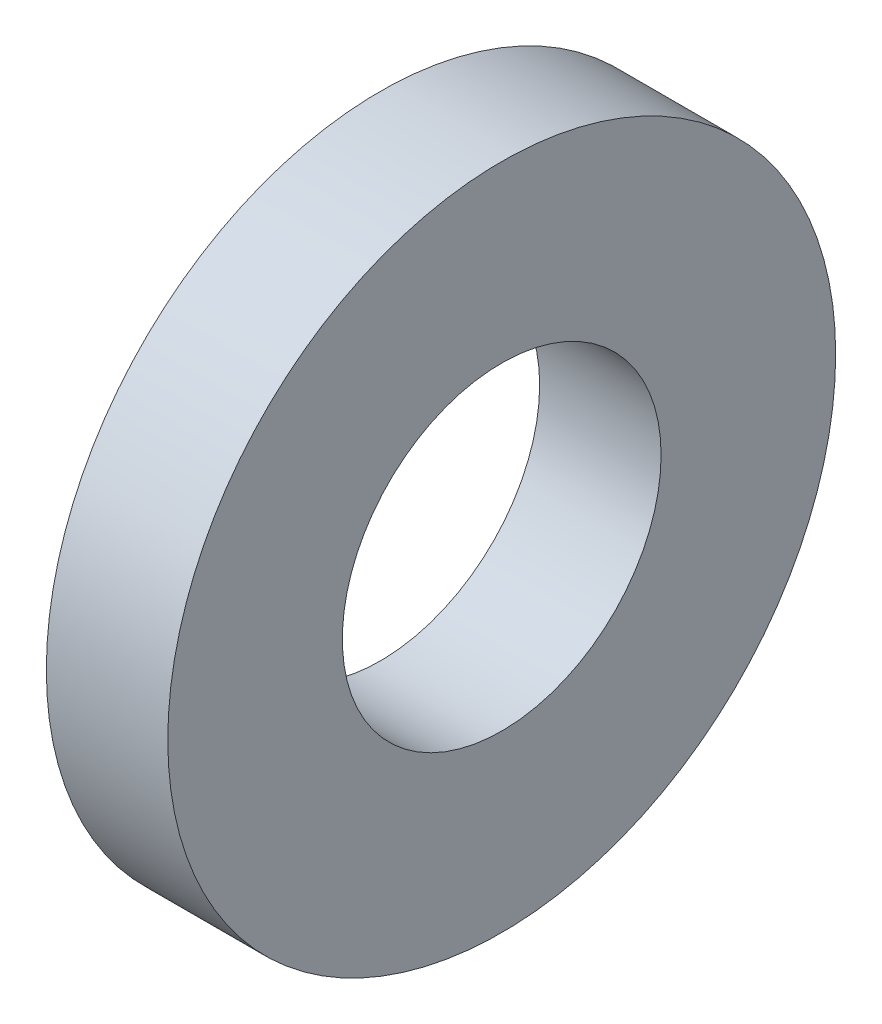
from build123d import *

# Parameters (mm, degrees)
SKETCH1_R          = 22
SKETCH1_R_2        = 10.5
BASE_EXTRUDE_DEPTH = 8


with BuildPart() as part:
    # Sketch1 → Base-Extrude (new body)
    with BuildSketch(Plane(origin=(0, 0, 0), x_dir=(0, 0, -1), z_dir=(1, 0, 0))):
        Circle(SKETCH1_R)
        Circle(SKETCH1_R_2, mode=Mode.SUBTRACT)
    extrude(amount=BASE_EXTRUDE_DEPTH)


solid = part.part
